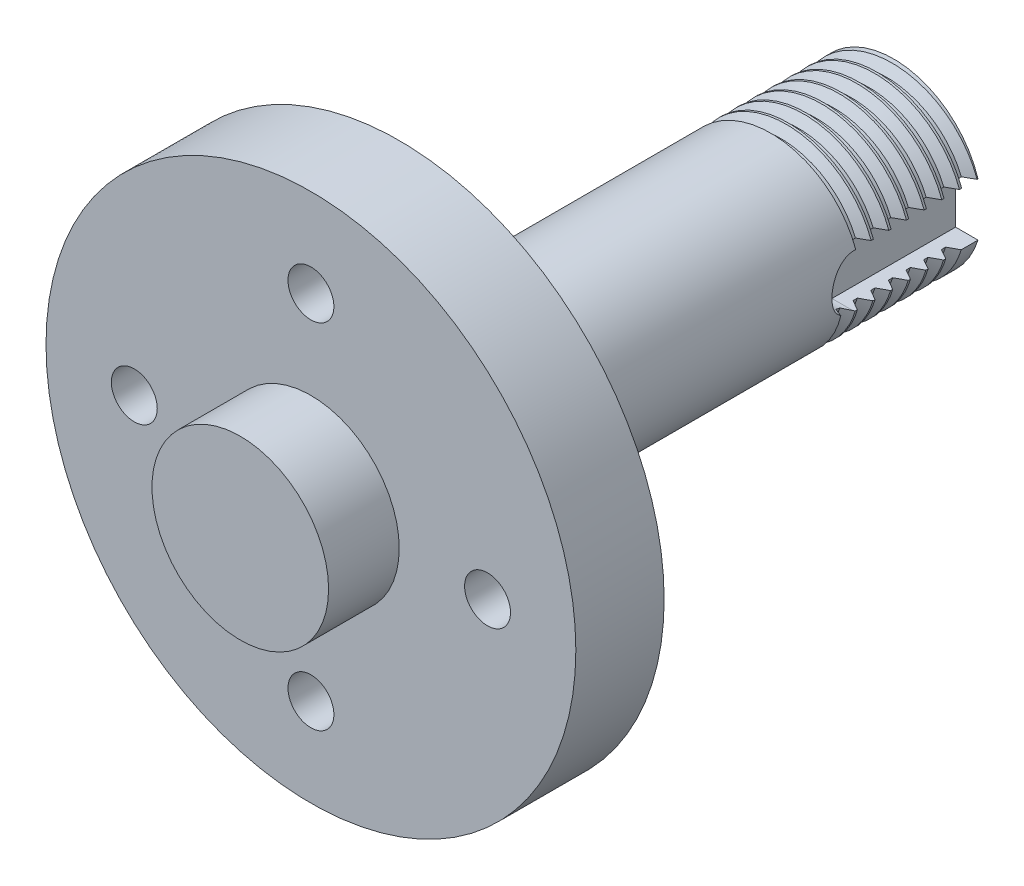
from build123d import *

# Parameters (mm, degrees)
SKETCH1_R                   = 5
BOSS_EXTRUDE1_DEPTH         = 24
SKETCH2_R                   = 6
BOSS_EXTRUDE2_DEPTH         = 4
SKETCH3_R                   = 15
BOSS_EXTRUDE3_DEPTH         = 5
SKETCH4_R                   = 5
BOSS_EXTRUDE4_DEPTH         = 4
TAP_DRILL_FOR_M3X0_5_TAP1_D = 2.6
SKETCH7_W                   = 1.5
SKETCH7_H                   = 3
CUT_EXTRUDE5_DEPTH          = 7
CUT_EXTRUDE6_DEPTH          = 45.002840817
CUT_EXTRUDE6_DEPTH_BACK     = 1
SKETCH8_R                   = 1.5
SKETCH9_R                   = 1.5
BOSS_EXTRUDE5_DEPTH         = 1
THREAD1_PITCH               = 1


with BuildPart() as part:
    # Sketch1 → Boss-Extrude1 (new body)
    with BuildSketch(Plane.XY):
        Circle(SKETCH1_R)
    extrude(amount=BOSS_EXTRUDE1_DEPTH)

    # Sketch2 → Boss-Extrude2 (add)
    with BuildSketch(Plane.XY.offset(24)):
        Circle(SKETCH2_R)
    extrude(amount=BOSS_EXTRUDE2_DEPTH)

    # Sketch3 → Boss-Extrude3 (add)
    with BuildSketch(Plane.XY.offset(28)):
        Circle(SKETCH3_R)
    extrude(amount=BOSS_EXTRUDE3_DEPTH)

    # Sketch4 → Boss-Extrude4 (add)
    with BuildSketch(Plane.XY.offset(33)):
        Circle(SKETCH4_R)
    extrude(amount=BOSS_EXTRUDE4_DEPTH)

    # Tap Drill for M3x0.5 Tap1 (through all)
    with Locations(Plane.XY.offset(33)):
        with Locations((0, 10), (10, 0), (0, -10), (-10, 0)):
            Hole(TAP_DRILL_FOR_M3X0_5_TAP1_D / 2)

    # Sketch7 → Cut-Extrude5 (cut)
    with BuildSketch(Plane(origin=(0, 0, 0), x_dir=(-1, 0, 0), z_dir=(0, 0, -1))):
        with Locations((-4.25, 0)):
            Rectangle(SKETCH7_W, SKETCH7_H)
    extrude(amount=-CUT_EXTRUDE5_DEPTH, mode=Mode.SUBTRACT)

    # Sketch8 → Cut-Extrude6 (cut, two sides: drawn at the far end of the back side and taken through both)
    with BuildSketch(Plane(origin=(3.5, 0, 0), x_dir=(0, 0, -1), z_dir=(1, 0, 0)).offset(-CUT_EXTRUDE6_DEPTH_BACK)):
        with Locations(Location((-7, 0, 0), (0, 0, 90))):
            Circle(SKETCH8_R)
    extrude(amount=CUT_EXTRUDE6_DEPTH + CUT_EXTRUDE6_DEPTH_BACK, mode=Mode.SUBTRACT)

    # Sketch9 → Boss-Extrude5 (add)
    with BuildSketch(Plane(origin=(2.5, 0, 0), x_dir=(0, 0, -1), z_dir=(1, 0, 0))):
        with Locations((-7, 0)):
            Circle(SKETCH9_R)
    extrude(amount=BOSS_EXTRUDE5_DEPTH)

    # Thread1: the profile of Thread Profile1 profile screwed along a right-hand helix of 7 turns, 8 arcs to a turn; built about Z, then put on its axis
    thread1_z = Axis((0, 0, 0), (0, 0, 1))
    thread1_corners = [(5.0003, 0, -0.000173205), (5.0003, 0, 0.875173202), (4.458734125, 0, 0.562499999), (4.458734125, 0, 0.312499999)]
    with BuildLine(mode=Mode.PRIVATE) as thread1_profile:
        Line(thread1_corners[0], thread1_corners[1])
        Line(thread1_corners[1], thread1_corners[2])
        Line(thread1_corners[2], thread1_corners[3])
        Line(thread1_corners[3], thread1_corners[0])
    thread1_cap = Face(thread1_profile.wire())
    thread1_turn_angles = [0, 22.5, 45, 67.5, 90, 112.5, 135, 157.5, 180, 202.5, 225, 247.5, 270, 292.5, 315, 337.5, 360]
    thread1_turn_weights = [1, 0.9238795325112867, 1, 0.9238795325112867, 1, 0.9238795325112867, 1, 0.9238795325112867, 1, 0.9238795325112867, 1, 0.9238795325112867, 1, 0.9238795325112867, 1, 0.9238795325112867, 1]
    thread1_turn_rails = [Edge.make_bspline([Vector(p[0], p[1], 0).rotate(thread1_z, thread1_turn_angles[k]) / thread1_turn_weights[k] + Vector(0, 0, p[2] + THREAD1_PITCH * thread1_turn_angles[k] / 360) for k in range(17)], [0, 0, 0, 1, 1, 2, 2, 3, 3, 4, 4, 5, 5, 6, 6, 7, 7, 8, 8, 8], 2, thread1_turn_weights) for p in thread1_corners]
    thread1_turn_sides = [Face.make_surface_from_curves(thread1_turn_rails[p[0]], thread1_turn_rails[p[1]]) for p in [(0, 1), (1, 2), (2, 3), (3, 0)]]
    thread1 = Plane(origin=(0, 0, 0), x_dir=(1, 0, 0), z_dir=(0, 0, 1)) * Solid(Shell([*[p.moved(Location((0, 0, THREAD1_PITCH * i))) for i in range(7) for p in thread1_turn_sides], thread1_cap, thread1_cap.rotate(thread1_z, 2520).moved(Location((0, 0, THREAD1_PITCH * 2520 / 360)))]))
    add(thread1, mode=Mode.SUBTRACT)


solid = part.part
